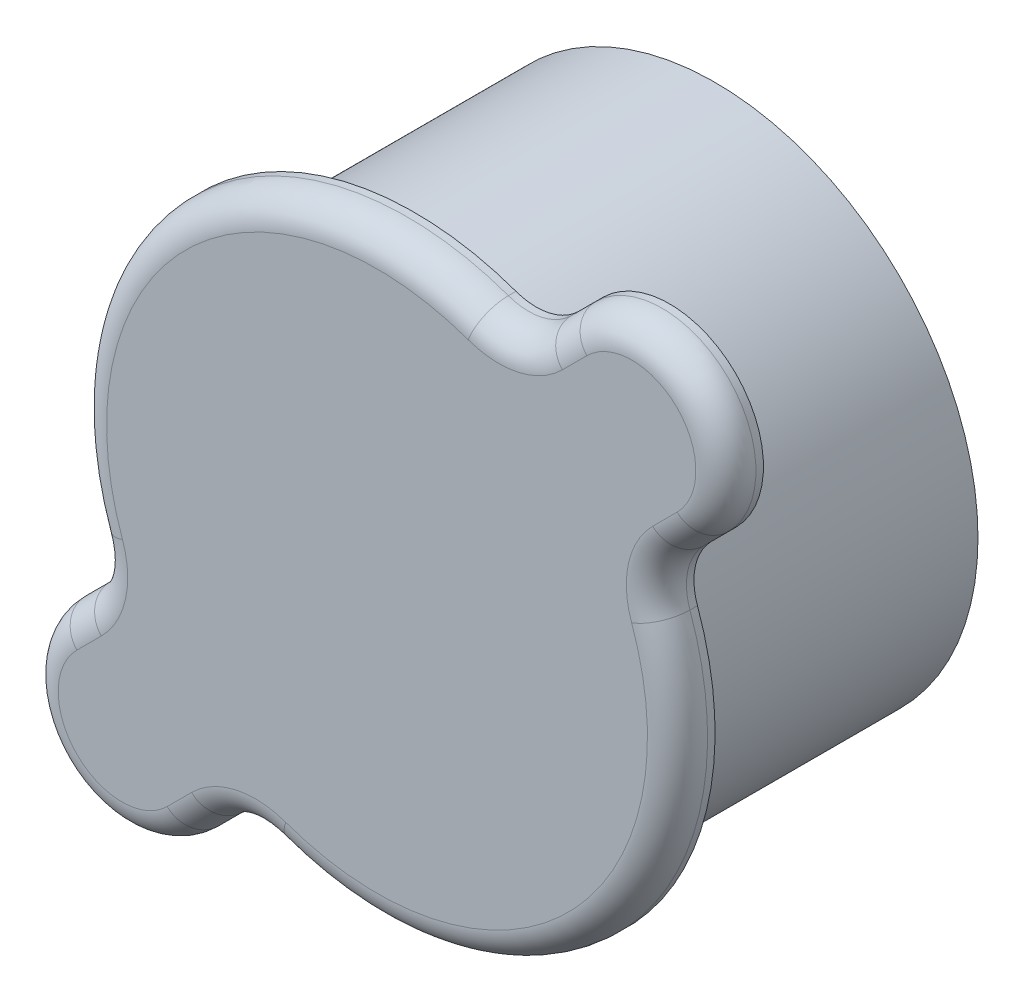
from build123d import *

# Parameters (mm, degrees)
BOSS_EXTRUDE1_DEPTH = 3.175
FILLET1_R           = 2.54
SKETCH1_3_R         = 22.225
BOSS_EXTRUDE2_DEPTH = 25.4


with BuildPart() as part:
    # Sketch1 → Boss-Extrude1 (new body)
    with BuildSketch(Plane.XY):
        with BuildLine():
            ThreePointArc((27.165274766, 15.939954615), (27.165274766, 27.165274766), (15.939954615, 27.165274766))
            Line((15.939954615, 27.165274766), (13.875478544, 25.100798696))
            ThreePointArc((13.875478544, 25.100798696), (11.395117189, 23.736044101), (8.56948008, 23.910750953))
            ThreePointArc((8.56948008, 23.910750953), (-17.960512242, 17.960512242), (-23.910750953, -8.56948008))
            ThreePointArc((-23.910750953, -8.56948008), (-23.736044101, -11.395117189), (-25.100798696, -13.875478544))
            Line((-25.100798696, -13.875478544), (-27.165274766, -15.939954615))
            ThreePointArc((-27.165274766, -15.939954615), (-27.165274766, -27.165274766), (-15.939954615, -27.165274766))
            Line((-15.939954615, -27.165274766), (-13.875478544, -25.100798696))
            ThreePointArc((-13.875478544, -25.100798696), (-11.395117189, -23.736044101), (-8.56948008, -23.910750953))
            ThreePointArc((-8.56948008, -23.910750953), (17.960512242, -17.960512242), (23.910750953, 8.56948008))
            ThreePointArc((23.910750953, 8.56948008), (23.736044101, 11.395117189), (25.100798696, 13.875478544))
            Line((25.100798696, 13.875478544), (27.165274766, 15.939954615))
        make_face()
    extrude(amount=BOSS_EXTRUDE1_DEPTH)

    # Fillet1
    fillet1_edges = [part.edges().sort_by_distance(p)[0] for p in [
        (23.736044101, 11.395117189, 3.175),
        (17.960512242, -17.960512242, 3.175),
        (-11.395117189, -23.736044101, 3.175),
        (-14.90771658, -26.133036731, 3.175),
        (-27.165274766, -27.165274766, 3.175),
        (-26.133036731, -14.90771658, 3.175),
        (-23.736044101, -11.395117189, 3.175),
        (-17.960512242, 17.960512242, 3.175),
        (11.395117189, 23.736044101, 3.175),
        (14.90771658, 26.133036731, 3.175),
        (27.165274766, 27.165274766, 3.175),
        (26.133036731, 14.90771658, 3.175),
    ]]
    fillet(fillet1_edges, radius=FILLET1_R)

    # Sketch1<3> → Boss-Extrude2 (add)
    with BuildSketch(Plane.XY):
        Circle(SKETCH1_3_R)
    extrude(amount=-BOSS_EXTRUDE2_DEPTH)


solid = part.part
